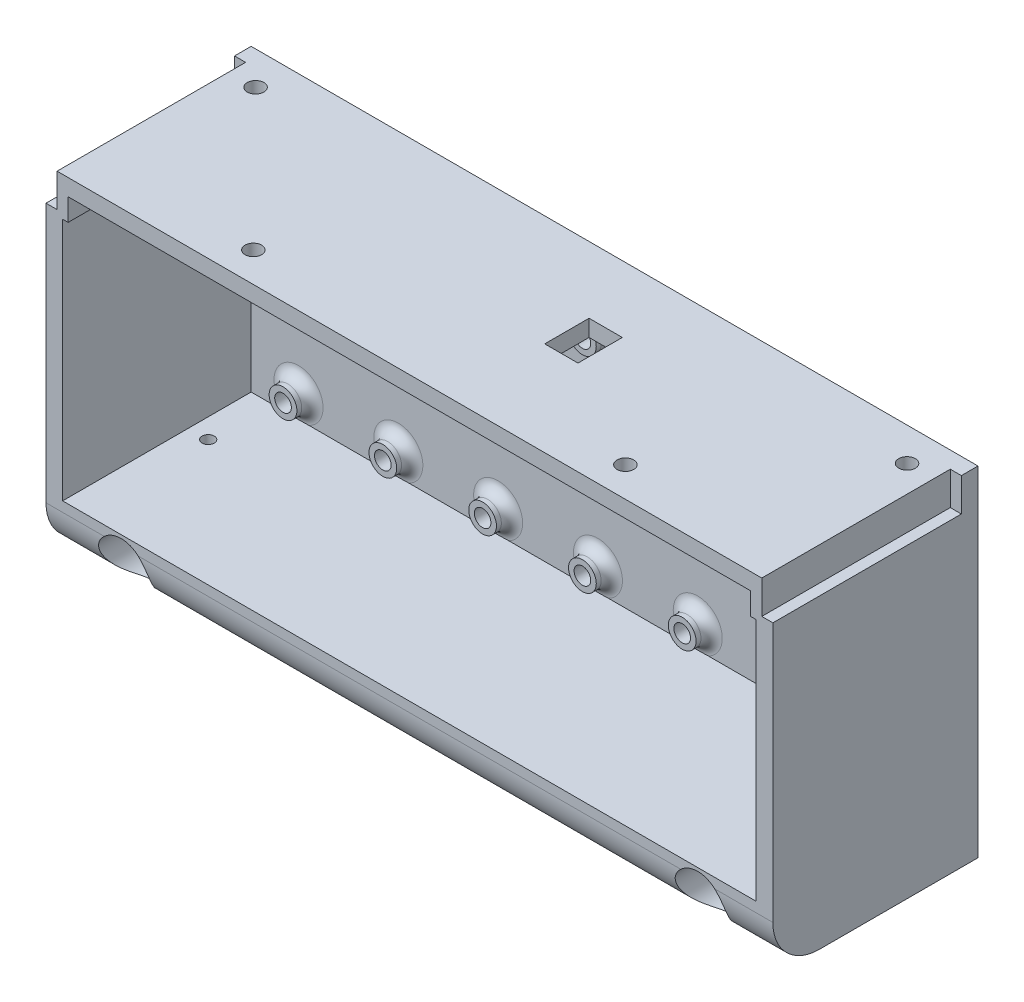
from build123d import *

# Parameters (mm, degrees)
CROQUIS2_W              = 131.1
CROQUIS2_H              = 54
SALIENTE_EXTRUIR2_DEPTH = 3
CROQUIS3_W              = 125.1
CROQUIS3_H              = 44
CROQUIS3_W_2            = 2
CROQUIS3_H_2            = 6
SALIENTE_EXTRUIR3_DEPTH = 34
CROQUIS4_W              = 131.1
CROQUIS4_H              = 37
SALIENTE_EXTRUIR4_DEPTH = 7.2
CROQUIS5_W              = 61.55
CROQUIS5_H              = 4
CORTAR_EXTRUIR1_DEPTH   = 34
CORTAR_EXTRUIR2_REACH   = 150.133
CROQUIS6_R              = 1.5
CROQUIS6_W              = 6
CROQUIS6_H              = 8
CROQUIS8_R              = 4.5
CORTAR_EXTRUIR3_DEPTH   = 33
CROQUIS9_R              = 2.5
CORTAR_EXTRUIR4_DEPTH   = 150.337369737
REDONDEO1_START         = -1
REDONDEO1_DEPTH         = 133
CROQUIS10_R             = 2.5
CROQUIS10_R_2           = 1.5
SALIENTE_EXTRUIR5_DEPTH = 2.8
REDONDEO2_R             = 1.92
CORTAR_EXTRUIR5_REACH   = 151.337
CROQUIS11_R             = 1.1


with BuildPart() as part:
    # Croquis2 → Saliente-Extruir2 (new body)
    with BuildSketch(Plane.XY):
        with Locations((65.55, -27)):
            Rectangle(CROQUIS2_W, CROQUIS2_H)
    extrude(amount=SALIENTE_EXTRUIR2_DEPTH)

    # Croquis3 → Saliente-Extruir3 (add)
    # profile 1 of 3: a face of its own
    with BuildSketch(Plane.XY.offset(3)):
        Polygon((2, -6), (0, -6), (0, -54), (131.1, -54), (131.1, -6), (129.1, -6), (129.1, 0), (68.55, 0), (68.55, -6), (66.55, -6), (66.55, 0), (65.55, 0), (64.55, 0), (64.55, -6), (62.55, -6), (62.55, 0), (2, 0), align=None)
        with Locations((65.55, -29)):
            Rectangle(CROQUIS3_W, CROQUIS3_H, mode=Mode.SUBTRACT)
    # profile 2 of 3: a face of its own
    with BuildSketch(Plane.XY.offset(3)):
        with Locations((63.55, -3)):
            Rectangle(CROQUIS3_W_2, CROQUIS3_H_2)
    # profile 3 of 3: a face of its own
    with BuildSketch(Plane.XY.offset(3)):
        with Locations((67.55, -3)):
            Rectangle(CROQUIS3_W_2, CROQUIS3_H_2)
    extrude(amount=SALIENTE_EXTRUIR3_DEPTH)

    # Croquis4 → Saliente-Extruir4 (add)
    with BuildSketch(Plane.XZ.offset(54)):
        with Locations((65.55, 18.5)):
            Rectangle(CROQUIS4_W, CROQUIS4_H)
    extrude(amount=SALIENTE_EXTRUIR4_DEPTH)

    # Croquis5 → Cortar-Extruir1 (cut)
    with BuildSketch(Plane.XY.offset(37)):
        with Locations((34.775, -5)):
            Rectangle(CROQUIS5_W, CROQUIS5_H)
        with Locations((96.325, -5)):
            Rectangle(CROQUIS5_W, CROQUIS5_H)
    extrude(amount=-CORTAR_EXTRUIR1_DEPTH, mode=Mode.SUBTRACT)

    # Croquis6 → Cortar-Extruir2 (cut, up to next)
    with BuildSketch(Plane.XZ.offset(3), mode=Mode.PRIVATE) as cortar_extruir2_sk1:
        with Locations(Location((32, 31.6, 0), (0, 0, 270))):
            Circle(CROQUIS6_R)
    cortar_extruir2_tool1 = extrude(cortar_extruir2_sk1.sketch, amount=-CORTAR_EXTRUIR2_REACH, mode=Mode.PRIVATE) & part.part
    # Croquis6 → Cortar-Extruir2 (cut, up to next)
    with BuildSketch(Plane.XZ.offset(3), mode=Mode.PRIVATE) as cortar_extruir2_sk2:
        with Locations(Location((99.1, 31.6, 0), (0, 0, 270))):
            Circle(CROQUIS6_R)
    cortar_extruir2_tool2 = extrude(cortar_extruir2_sk2.sketch, amount=-CORTAR_EXTRUIR2_REACH, mode=Mode.PRIVATE) & part.part
    # Croquis6 → Cortar-Extruir2 (cut, up to next)
    with BuildSketch(Plane.XZ.offset(3), mode=Mode.PRIVATE) as cortar_extruir2_sk3:
        with Locations(Location((6.8, 6, 0), (0, 0, 270))):
            Circle(CROQUIS6_R)
    cortar_extruir2_tool3 = extrude(cortar_extruir2_sk3.sketch, amount=-CORTAR_EXTRUIR2_REACH, mode=Mode.PRIVATE) & part.part
    # Croquis6 → Cortar-Extruir2 (cut, up to next)
    with BuildSketch(Plane.XZ.offset(3), mode=Mode.PRIVATE) as cortar_extruir2_sk4:
        with Locations(Location((124.3, 6, 0), (0, 0, 270))):
            Circle(CROQUIS6_R)
    cortar_extruir2_tool4 = extrude(cortar_extruir2_sk4.sketch, amount=-CORTAR_EXTRUIR2_REACH, mode=Mode.PRIVATE) & part.part
    # Croquis6 → Cortar-Extruir2 (cut, up to next)
    with BuildSketch(Plane.XZ.offset(3), mode=Mode.PRIVATE) as cortar_extruir2_sk5:
        with Locations((75.95, 16)):
            Rectangle(CROQUIS6_W, CROQUIS6_H)
    cortar_extruir2_tool5 = extrude(cortar_extruir2_sk5.sketch, amount=-CORTAR_EXTRUIR2_REACH, mode=Mode.PRIVATE) & part.part
    add(cortar_extruir2_tool1.solids().sort_by_distance((32, -3, 31.6))[0], mode=Mode.SUBTRACT)
    add(cortar_extruir2_tool2.solids().sort_by_distance((99.1, -3, 31.6))[0], mode=Mode.SUBTRACT)
    add(cortar_extruir2_tool3.solids().sort_by_distance((6.8, -3, 6))[0], mode=Mode.SUBTRACT)
    add(cortar_extruir2_tool4.solids().sort_by_distance((124.3, -3, 6))[0], mode=Mode.SUBTRACT)
    add(cortar_extruir2_tool5.solids().sort_by_distance((75.95, -3, 16))[0], mode=Mode.SUBTRACT)

    # Croquis8 → Cortar-Extruir3 (cut)
    with BuildSketch(Plane.XY.offset(37)):
        with Locations((13.55, -56.1)):
            Circle(CROQUIS8_R)
        with Locations(Location((117.55, -56.1, 0), (0, 0, 180))):
            Circle(CROQUIS8_R)
    extrude(amount=-CORTAR_EXTRUIR3_DEPTH, mode=Mode.SUBTRACT)

    # Croquis9 → Cortar-Extruir4 (cut, through all)
    with BuildSketch(Plane.XY.offset(37)):
        with Locations((13.55, -56.1)):
            Circle(CROQUIS9_R)
        with Locations((117.55, -56.1)):
            Circle(CROQUIS9_R)
    extrude(amount=-CORTAR_EXTRUIR4_DEPTH, mode=Mode.SUBTRACT)

    # Redondeo1: read off the stored shape, not the designer's step
    # Redondeo1 outline → Redondeo1 (cut)
    with BuildSketch(Plane.YZ.offset(REDONDEO1_START)):
        with BuildLine():
            Line((-61.2, 37), (-61.2, 28.6))
            ThreePointArc((-61.2, 28.6), (-58.739696962, 34.539696962), (-52.8, 37))
            Line((-52.8, 37), (-61.2, 37))
        make_face()
    extrude(amount=REDONDEO1_DEPTH, mode=Mode.SUBTRACT)

    # Croquis10 → Saliente-Extruir5 (add)
    # profile 1 of 14: a face of its own
    with BuildSketch(Plane.XY.offset(3)):
        with Locations(Location((65.55, -10, 0), (0, 0, 180))):
            Circle(CROQUIS10_R)
        with Locations((65.55, -10)):
            Circle(CROQUIS10_R_2, mode=Mode.SUBTRACT)
    # profile 2 of 14: a face of its own
    with BuildSketch(Plane.XY.offset(3)):
        with Locations(Location((83.55, -10, 0), (0, 0, 180))):
            Circle(CROQUIS10_R)
        with Locations((83.55, -10)):
            Circle(CROQUIS10_R_2, mode=Mode.SUBTRACT)
    # profile 3 of 14: a face of its own
    with BuildSketch(Plane.XY.offset(3)):
        with Locations(Location((101.55, -10, 0), (0, 0, 180))):
            Circle(CROQUIS10_R)
        with Locations((101.55, -10)):
            Circle(CROQUIS10_R_2, mode=Mode.SUBTRACT)
    # profile 4 of 14: a face of its own
    with BuildSketch(Plane.XY.offset(3)):
        with Locations(Location((119.55, -10, 0), (0, 0, 180))):
            Circle(CROQUIS10_R)
        with Locations((119.55, -10)):
            Circle(CROQUIS10_R_2, mode=Mode.SUBTRACT)
    # profile 5 of 14: a face of its own
    with BuildSketch(Plane.XY.offset(3)):
        with Locations(Location((83.55, -47, 0), (0, 0, 180))):
            Circle(CROQUIS10_R)
        with Locations((83.55, -47)):
            Circle(CROQUIS10_R_2, mode=Mode.SUBTRACT)
    # profile 6 of 14: a face of its own
    with BuildSketch(Plane.XY.offset(3)):
        with Locations(Location((101.55, -47, 0), (0, 0, 180))):
            Circle(CROQUIS10_R)
        with Locations((101.55, -47)):
            Circle(CROQUIS10_R_2, mode=Mode.SUBTRACT)
    # profile 7 of 14: a face of its own
    with BuildSketch(Plane.XY.offset(3)):
        with Locations(Location((119.55, -47, 0), (0, 0, 180))):
            Circle(CROQUIS10_R)
        with Locations((119.55, -47)):
            Circle(CROQUIS10_R_2, mode=Mode.SUBTRACT)
    # profile 8 of 14: a face of its own
    with BuildSketch(Plane.XY.offset(3)):
        with Locations(Location((47.55, -10, 0), (0, 0, 180))):
            Circle(CROQUIS10_R)
        with Locations((47.55, -10)):
            Circle(CROQUIS10_R_2, mode=Mode.SUBTRACT)
    # profile 9 of 14: a face of its own
    with BuildSketch(Plane.XY.offset(3)):
        with Locations(Location((29.55, -10, 0), (0, 0, 180))):
            Circle(CROQUIS10_R)
        with Locations((29.55, -10)):
            Circle(CROQUIS10_R_2, mode=Mode.SUBTRACT)
    # profile 10 of 14: a face of its own
    with BuildSketch(Plane.XY.offset(3)):
        with Locations(Location((11.55, -10, 0), (0, 0, 180))):
            Circle(CROQUIS10_R)
        with Locations((11.55, -10)):
            Circle(CROQUIS10_R_2, mode=Mode.SUBTRACT)
    # profile 11 of 14: a face of its own
    with BuildSketch(Plane.XY.offset(3)):
        with Locations(Location((47.55, -47, 0), (0, 0, 180))):
            Circle(CROQUIS10_R)
        with Locations((47.55, -47)):
            Circle(CROQUIS10_R_2, mode=Mode.SUBTRACT)
    # profile 12 of 14: a face of its own
    with BuildSketch(Plane.XY.offset(3)):
        with Locations(Location((29.55, -47, 0), (0, 0, 180))):
            Circle(CROQUIS10_R)
        with Locations((29.55, -47)):
            Circle(CROQUIS10_R_2, mode=Mode.SUBTRACT)
    # profile 13 of 14: a face of its own
    with BuildSketch(Plane.XY.offset(3)):
        with Locations(Location((11.55, -47, 0), (0, 0, 180))):
            Circle(CROQUIS10_R)
        with Locations((11.55, -47)):
            Circle(CROQUIS10_R_2, mode=Mode.SUBTRACT)
    # profile 14 of 14: a face of its own
    with BuildSketch(Plane.XY.offset(3)):
        with Locations(Location((65.55, -47, 0), (0, 0, 180))):
            Circle(CROQUIS10_R)
        with Locations((65.55, -47)):
            Circle(CROQUIS10_R_2, mode=Mode.SUBTRACT)
    extrude(amount=SALIENTE_EXTRUIR5_DEPTH)

    # Redondeo2
    # the kernel refuses this fillet: 1.92 mm, written as the material it adds along each edge
    with BuildSketch(Plane(origin=(65.55, -10, 3), x_dir=(-1, 0, 0), z_dir=(0, 1, 0))) as redondeo2_piece_1:
        with BuildLine():
            CenterArc((2.5 + REDONDEO2_R, REDONDEO2_R), REDONDEO2_R, 180, 90)
            Line((2.5, REDONDEO2_R), (2.5, 0))
            Line((2.5, 0), (2.5 + REDONDEO2_R, 0))
        make_face()
    revolve(axis=Axis((65.55, -10, 3), (0, 0, 1)))
    with BuildSketch(Plane(origin=(83.55, -10, 3), x_dir=(-1, 0, 0), z_dir=(0, 1, 0))) as redondeo2_piece_2:
        with BuildLine():
            CenterArc((2.5 + REDONDEO2_R, REDONDEO2_R), REDONDEO2_R, 180, 90)
            Line((2.5, REDONDEO2_R), (2.5, 0))
            Line((2.5, 0), (2.5 + REDONDEO2_R, 0))
        make_face()
    revolve(axis=Axis((83.55, -10, 3), (0, 0, 1)))
    with BuildSketch(Plane(origin=(101.55, -10, 3), x_dir=(-1, 0, 0), z_dir=(0, 1, 0))) as redondeo2_piece_3:
        with BuildLine():
            CenterArc((2.5 + REDONDEO2_R, REDONDEO2_R), REDONDEO2_R, 180, 90)
            Line((2.5, REDONDEO2_R), (2.5, 0))
            Line((2.5, 0), (2.5 + REDONDEO2_R, 0))
        make_face()
    revolve(axis=Axis((101.55, -10, 3), (0, 0, 1)))
    with BuildSketch(Plane(origin=(119.55, -10, 3), x_dir=(-1, 0, 0), z_dir=(0, 1, 0))) as redondeo2_piece_4:
        with BuildLine():
            CenterArc((2.5 + REDONDEO2_R, REDONDEO2_R), REDONDEO2_R, 180, 90)
            Line((2.5, REDONDEO2_R), (2.5, 0))
            Line((2.5, 0), (2.5 + REDONDEO2_R, 0))
        make_face()
    revolve(axis=Axis((119.55, -10, 3), (0, 0, 1)))
    with BuildSketch(Plane(origin=(83.55, -47, 3), x_dir=(-1, 0, 0), z_dir=(0, 1, 0))) as redondeo2_piece_5:
        with BuildLine():
            CenterArc((2.5 + REDONDEO2_R, REDONDEO2_R), REDONDEO2_R, 180, 90)
            Line((2.5, REDONDEO2_R), (2.5, 0))
            Line((2.5, 0), (2.5 + REDONDEO2_R, 0))
        make_face()
    revolve(axis=Axis((83.55, -47, 3), (0, 0, 1)))
    with BuildSketch(Plane(origin=(101.55, -47, 3), x_dir=(-1, 0, 0), z_dir=(0, 1, 0))) as redondeo2_piece_6:
        with BuildLine():
            CenterArc((2.5 + REDONDEO2_R, REDONDEO2_R), REDONDEO2_R, 180, 90)
            Line((2.5, REDONDEO2_R), (2.5, 0))
            Line((2.5, 0), (2.5 + REDONDEO2_R, 0))
        make_face()
    revolve(axis=Axis((101.55, -47, 3), (0, 0, 1)))
    with BuildSketch(Plane(origin=(119.55, -47, 3), x_dir=(-1, 0, 0), z_dir=(0, 1, 0))) as redondeo2_piece_7:
        with BuildLine():
            CenterArc((2.5 + REDONDEO2_R, REDONDEO2_R), REDONDEO2_R, 180, 90)
            Line((2.5, REDONDEO2_R), (2.5, 0))
            Line((2.5, 0), (2.5 + REDONDEO2_R, 0))
        make_face()
    revolve(axis=Axis((119.55, -47, 3), (0, 0, 1)))
    with BuildSketch(Plane(origin=(47.55, -10, 3), x_dir=(-1, 0, 0), z_dir=(0, 1, 0))) as redondeo2_piece_8:
        with BuildLine():
            CenterArc((2.5 + REDONDEO2_R, REDONDEO2_R), REDONDEO2_R, 180, 90)
            Line((2.5, REDONDEO2_R), (2.5, 0))
            Line((2.5, 0), (2.5 + REDONDEO2_R, 0))
        make_face()
    revolve(axis=Axis((47.55, -10, 3), (0, 0, 1)))
    with BuildSketch(Plane(origin=(29.55, -10, 3), x_dir=(-1, 0, 0), z_dir=(0, 1, 0))) as redondeo2_piece_9:
        with BuildLine():
            CenterArc((2.5 + REDONDEO2_R, REDONDEO2_R), REDONDEO2_R, 180, 90)
            Line((2.5, REDONDEO2_R), (2.5, 0))
            Line((2.5, 0), (2.5 + REDONDEO2_R, 0))
        make_face()
    revolve(axis=Axis((29.55, -10, 3), (0, 0, 1)))
    with BuildSketch(Plane(origin=(11.55, -10, 3), x_dir=(-1, 0, 0), z_dir=(0, 1, 0))) as redondeo2_piece_10:
        with BuildLine():
            CenterArc((2.5 + REDONDEO2_R, REDONDEO2_R), REDONDEO2_R, 180, 90)
            Line((2.5, REDONDEO2_R), (2.5, 0))
            Line((2.5, 0), (2.5 + REDONDEO2_R, 0))
        make_face()
    revolve(axis=Axis((11.55, -10, 3), (0, 0, 1)))
    with BuildSketch(Plane(origin=(47.55, -47, 3), x_dir=(-1, 0, 0), z_dir=(0, 1, 0))) as redondeo2_piece_11:
        with BuildLine():
            CenterArc((2.5 + REDONDEO2_R, REDONDEO2_R), REDONDEO2_R, 180, 90)
            Line((2.5, REDONDEO2_R), (2.5, 0))
            Line((2.5, 0), (2.5 + REDONDEO2_R, 0))
        make_face()
    revolve(axis=Axis((47.55, -47, 3), (0, 0, 1)))
    with BuildSketch(Plane(origin=(29.55, -47, 3), x_dir=(-1, 0, 0), z_dir=(0, 1, 0))) as redondeo2_piece_12:
        with BuildLine():
            CenterArc((2.5 + REDONDEO2_R, REDONDEO2_R), REDONDEO2_R, 180, 90)
            Line((2.5, REDONDEO2_R), (2.5, 0))
            Line((2.5, 0), (2.5 + REDONDEO2_R, 0))
        make_face()
    revolve(axis=Axis((29.55, -47, 3), (0, 0, 1)))
    with BuildSketch(Plane(origin=(11.55, -47, 3), x_dir=(-1, 0, 0), z_dir=(0, 1, 0))) as redondeo2_piece_13:
        with BuildLine():
            CenterArc((2.5 + REDONDEO2_R, REDONDEO2_R), REDONDEO2_R, 180, 90)
            Line((2.5, REDONDEO2_R), (2.5, 0))
            Line((2.5, 0), (2.5 + REDONDEO2_R, 0))
        make_face()
    revolve(axis=Axis((11.55, -47, 3), (0, 0, 1)))
    with BuildSketch(Plane(origin=(65.55, -47, 3), x_dir=(-1, 0, 0), z_dir=(0, 1, 0))) as redondeo2_piece_14:
        with BuildLine():
            CenterArc((2.5 + REDONDEO2_R, REDONDEO2_R), REDONDEO2_R, 180, 90)
            Line((2.5, REDONDEO2_R), (2.5, 0))
            Line((2.5, 0), (2.5 + REDONDEO2_R, 0))
        make_face()
    revolve(axis=Axis((65.55, -47, 3), (0, 0, 1)))

    # Croquis11 → Cortar-Extruir5 (cut, up to next)
    with BuildSketch(Plane.XZ.offset(61.2), mode=Mode.PRIVATE) as cortar_extruir5_sk1:
        with Locations((6.55, 14.3)):
            Circle(CROQUIS11_R)
    cortar_extruir5_tool1 = extrude(cortar_extruir5_sk1.sketch, amount=-CORTAR_EXTRUIR5_REACH, mode=Mode.PRIVATE) & part.part
    # Croquis11 → Cortar-Extruir5 (cut, up to next)
    with BuildSketch(Plane.XZ.offset(61.2), mode=Mode.PRIVATE) as cortar_extruir5_sk2:
        with Locations((124.55, 14.3)):
            Circle(CROQUIS11_R)
    cortar_extruir5_tool2 = extrude(cortar_extruir5_sk2.sketch, amount=-CORTAR_EXTRUIR5_REACH, mode=Mode.PRIVATE) & part.part
    add(cortar_extruir5_tool1.solids().sort_by_distance((6.55, -61.2, 14.3))[0], mode=Mode.SUBTRACT)
    add(cortar_extruir5_tool2.solids().sort_by_distance((124.55, -61.2, 14.3))[0], mode=Mode.SUBTRACT)


solid = part.part
